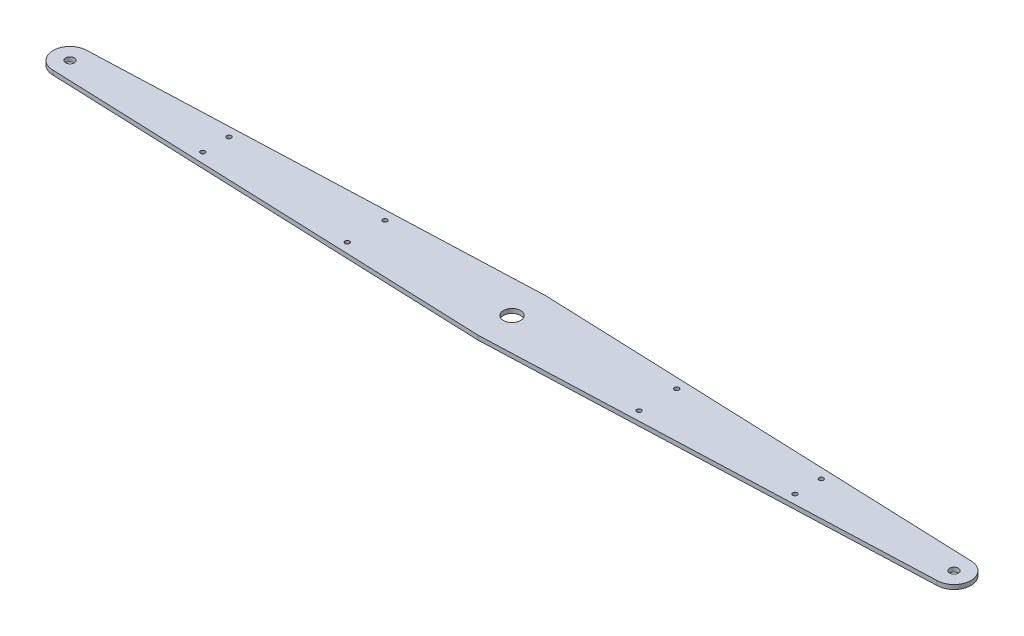
from build123d import *

# Parameters (mm, degrees)
BOSS_EXTRUDE1_DEPTH = 3.18
SKETCH3_R           = 6.35
SKETCH3_R_2         = 3.175
SKETCH3_R_3         = 1.65
CUT_EXTRUDE1_DEPTH  = 339.439599338


with BuildPart() as part:
    # Sketch2 → Boss-Extrude1 (new body)
    with BuildSketch(Plane(origin=(0, 0, 0), x_dir=(1, 0, 0), z_dir=(0, 1, 0))):
        with BuildLine():
            Line((-325, 12.5), (0, 25))
            Line((0, 25), (325, 12.5))
            ThreePointArc((325, 12.5), (337.5, 0), (325, -12.5))
            Line((325, -12.5), (0, -25))
            Line((0, -25), (-325, -12.5))
            ThreePointArc((-325, -12.5), (-337.5, 0), (-325, 12.5))
        make_face()
    extrude(amount=BOSS_EXTRUDE1_DEPTH)

    # Sketch3 → Cut-Extrude1 (cut, through all)
    with BuildSketch(Plane(origin=(0, 3.18, 0), x_dir=(1, 0, 0), z_dir=(0, 1, 0))):
        Circle(SKETCH3_R)
        with Locations((-325, 0)):
            Circle(SKETCH3_R_2)
        with Locations((-217.75, 9.625)):
            Circle(SKETCH3_R_3)
        with Locations((-107.25, -13.875)):
            Circle(SKETCH3_R_3)
        with Locations((325, 0)):
            Circle(SKETCH3_R_2)
        with Locations((-107.25, 13.875)):
            Circle(SKETCH3_R_3)
        with Locations((-217.75, -9.625)):
            Circle(SKETCH3_R_3)
        with Locations((107.25, -13.875)):
            Circle(SKETCH3_R_3)
        with Locations((107.25, 13.875)):
            Circle(SKETCH3_R_3)
        with Locations((217.75, -9.625)):
            Circle(SKETCH3_R_3)
        with Locations((217.75, 9.625)):
            Circle(SKETCH3_R_3)
    extrude(amount=-CUT_EXTRUDE1_DEPTH, mode=Mode.SUBTRACT)


solid = part.part
